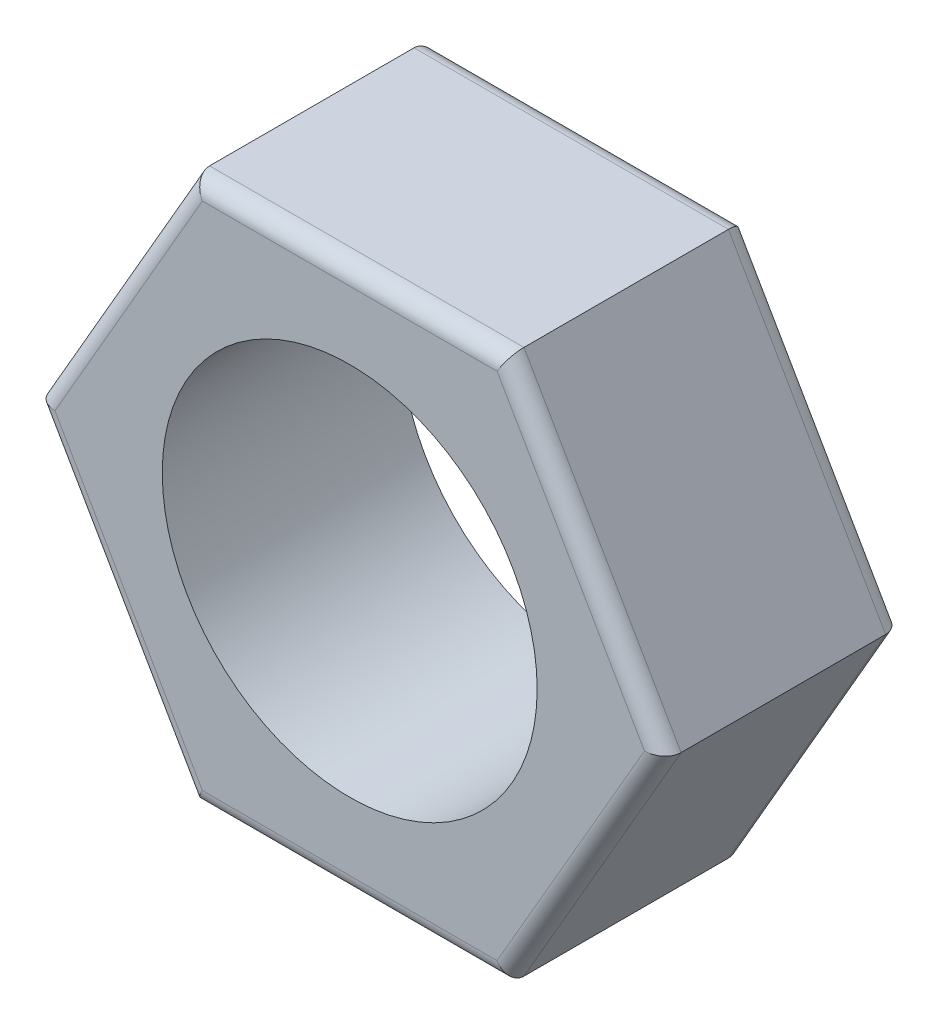
from build123d import *

# Parameters (mm, degrees)
EXTRUDE_1_DEPTH     = 14
SKETCH_3_R          = 11
CUT_EXTRUDE_2_DEPTH = 29.13724178
FILLET_1_R          = 1


with BuildPart() as part:
    # 草图2 → 拉伸1 (new body)
    with BuildSketch(Plane.XY):
        Polygon((9.225, -15.9781687), (18.45, 0), (9.225, 15.9781687), (-9.225, 15.9781687), (-18.45, 0), (-9.225, -15.9781687), align=None)
    extrude(amount=EXTRUDE_1_DEPTH)

    # 草图3 → 拉伸2 (cut, through all)
    with BuildSketch(Plane(origin=(0, 0, 0), x_dir=(-1, 0, 0), z_dir=(0, 0, -1))):
        Circle(SKETCH_3_R)
    extrude(amount=-CUT_EXTRUDE_2_DEPTH, mode=Mode.SUBTRACT)

    # 圆角1
    fillet_1_edges = [part.edges().sort_by_distance(p)[0] for p in [
        (0, -15.9781687, 14),
        (-13.8375, -7.98908435, 14),
        (-13.8375, 7.98908435, 14),
        (-13.8375, -7.98908435, 0),
        (0, -15.9781687, 0),
        (13.8375, -7.98908435, 0),
        (13.8375, 7.98908435, 0),
        (0, 15.9781687, 0),
        (-13.8375, 7.98908435, 0),
        (13.8375, -7.98908435, 14),
        (13.8375, 7.98908435, 14),
        (0, 15.9781687, 14),
    ]]
    fillet(fillet_1_edges, radius=FILLET_1_R)


solid = part.part
